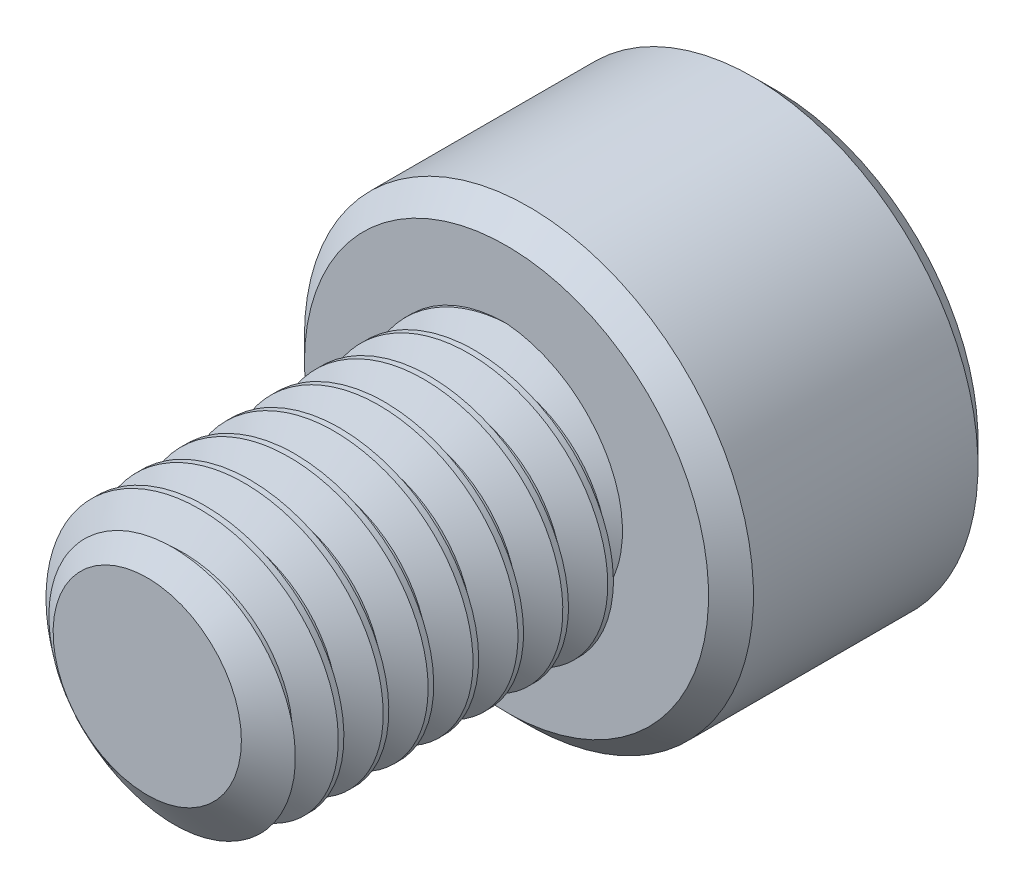
from build123d import *

# Parameters (mm, degrees)
SKETCH1_R          = 3
EXTRUDE1_DEPTH     = 8
CUT_SWEEP1_PITCH   = 1
SKETCH6_R          = 5
EXTRUDE2_DEPTH     = 6
CUT_EXTRUDE1_DEPTH = 3.75
CHAMFER1_SIZE      = 0.5


with BuildPart() as part:
    # Sketch1 → Extrude1 (new body)
    with BuildSketch(Plane.XY):
        Circle(SKETCH1_R)
    extrude(amount=-EXTRUDE1_DEPTH)

    # Cut-Sweep1: the profile of Sketch3 profile screwed along a right-hand helix of 9 turns, 6 arcs to a turn; built about Z, then put on its axis
    cut_sweep1_z = Axis((0, 0, 0), (0, 0, 1))
    cut_sweep1_corners = [(3.0003, 0, -0.875173205), (2.350480947, 0, -0.5), (2.350480947, 0, -0.375), (3.0003, 0, 0.000173205)]
    with BuildLine(mode=Mode.PRIVATE) as cut_sweep1_profile:
        Line(cut_sweep1_corners[0], cut_sweep1_corners[1])
        Line(cut_sweep1_corners[1], cut_sweep1_corners[2])
        Line(cut_sweep1_corners[2], cut_sweep1_corners[3])
        Line(cut_sweep1_corners[3], cut_sweep1_corners[0])
    cut_sweep1_cap = Face(cut_sweep1_profile.wire())
    cut_sweep1_turn_angles = [0, 30, 60, 90, 120, 150, 180, 210, 240, 270, 300, 330, 360]
    cut_sweep1_turn_weights = [1, 0.8660254037844387, 1, 0.8660254037844387, 1, 0.8660254037844387, 1, 0.8660254037844387, 1, 0.8660254037844387, 1, 0.8660254037844387, 1]
    cut_sweep1_turn_rails = [Edge.make_bspline([Vector(p[0], p[1], 0).rotate(cut_sweep1_z, cut_sweep1_turn_angles[k]) / cut_sweep1_turn_weights[k] + Vector(0, 0, p[2] + CUT_SWEEP1_PITCH * cut_sweep1_turn_angles[k] / 360) for k in range(13)], [0, 0, 0, 1, 1, 2, 2, 3, 3, 4, 4, 5, 5, 6, 6, 6], 2, cut_sweep1_turn_weights) for p in cut_sweep1_corners]
    cut_sweep1_turn_sides = [Face.make_surface_from_curves(cut_sweep1_turn_rails[p[0]], cut_sweep1_turn_rails[p[1]]) for p in [(0, 1), (1, 2), (2, 3), (3, 0)]]
    cut_sweep1 = Plane(origin=(0, 0, 0), x_dir=(0, 1, 0), z_dir=(0, 0, -1)) * Solid(Shell([*[p.moved(Location((0, 0, CUT_SWEEP1_PITCH * i))) for i in range(9) for p in cut_sweep1_turn_sides], cut_sweep1_cap, cut_sweep1_cap.rotate(cut_sweep1_z, 3240).moved(Location((0, 0, CUT_SWEEP1_PITCH * 3240 / 360)))]))
    add(cut_sweep1, mode=Mode.SUBTRACT)

    # Sketch4 → Cut-Revolve1 (revolve, cut)
    with BuildSketch(Plane(origin=(0, 0, 0), x_dir=(0, 0, -1), z_dir=(1, 0, 0)), mode=Mode.PRIVATE) as cut_revolve1_sk:
        Polygon((0.632650852, 3), (0, 2.096480947), (0, 3), align=None)
    revolve(cut_revolve1_sk.sketch.rotate(Axis((0, 0, 0), (0, 0, -1)), 244.349292568), axis=Axis((0, 0, 0), (0, 0, -1)), mode=Mode.SUBTRACT)

    # Sketch6 → Extrude2 (add)
    with BuildSketch(Plane(origin=(0, 0, -8), x_dir=(-1, 0, 0), z_dir=(0, 0, -1))):
        Circle(SKETCH6_R)
    extrude(amount=EXTRUDE2_DEPTH)

    # Sketch7 → Cut-Extrude1 (cut)
    with BuildSketch(Plane(origin=(0, 0, -14), x_dir=(-1, 0, 0), z_dir=(0, 0, -1))):
        Polygon((0, 2.886751346), (-2.5, 1.443375673), (-2.5, -1.443375673), (0, -2.886751346), (2.5, -1.443375673), (2.5, 1.443375673), align=None)
    extrude(amount=-CUT_EXTRUDE1_DEPTH, mode=Mode.SUBTRACT)

    # Cut-Extrude2 cone 1 section (through the dimple's axis) → Cut-Extrude2 (revolve, cut)
    with BuildSketch(Plane(origin=(0, 0, -14), x_dir=(0, 1, 0), z_dir=(1, 0, 0))):
        Polygon((0, 0), (2.886751346, 0), (0, 2.886751346), align=None)
    revolve(axis=Axis((0, 0, -14), (0, 0, 1)), mode=Mode.SUBTRACT)

    # Chamfer1
    chamfer1_edges = [part.edges().sort_by_distance(p)[0] for p in [
        (5, 0, -8),
        (5, 0, -14),
    ]]
    chamfer(chamfer1_edges, length=CHAMFER1_SIZE)


solid = part.part
